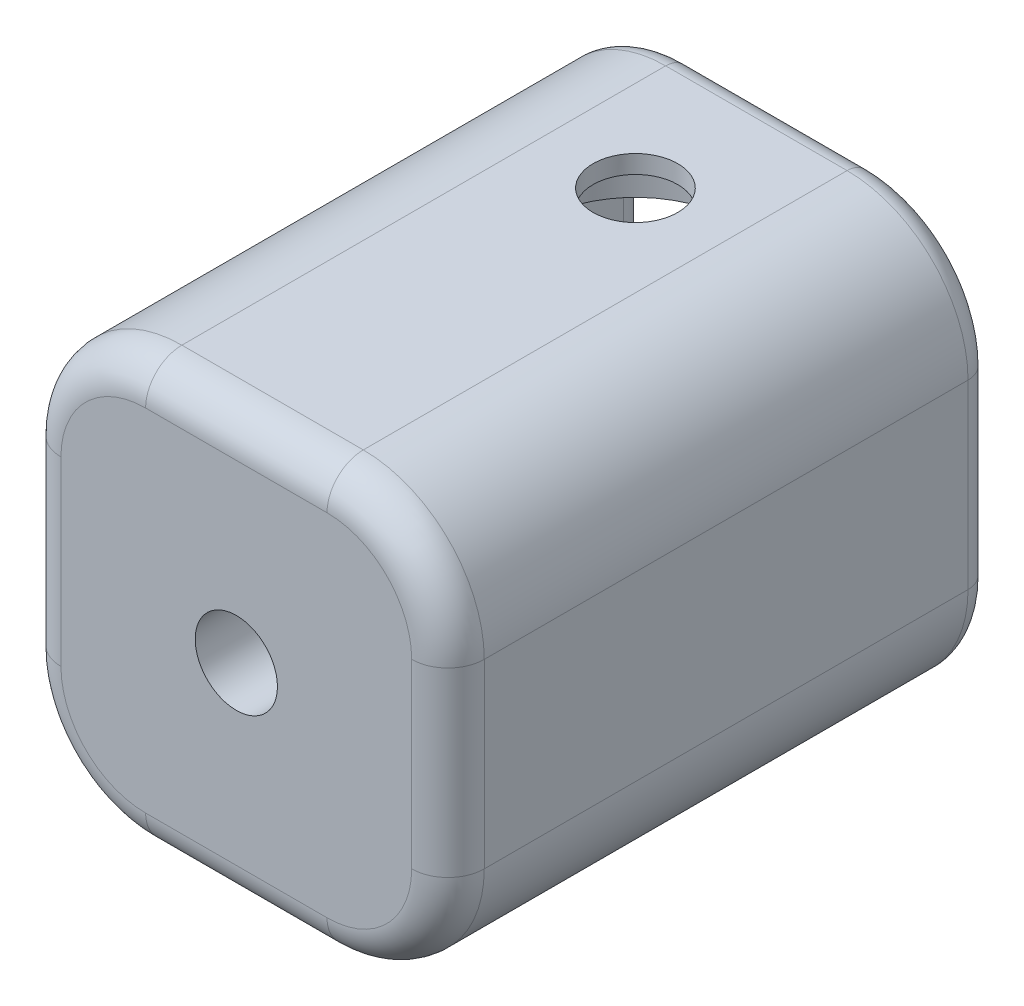
from build123d import *

# Parameters (mm, degrees)
SKETCH1_W                = 35
SKETCH1_H                = 35
SKETCH1_W_2              = 22
SKETCH1_H_2              = 22
BOSS_EXTRUDE1_DEPTH      = 30
SKETCH3_R                = 3.5
CUT_EXTRUDE2_DEPTH       = 50.307707308
SKETCH4_R                = 8.25
CUT_EXTRUDE3_DEPTH       = 5
FILLET1_R                = 10
FILLET4_R                = 2
FILLET5_R                = 3
NUT_START                = 15
NUT_RETENTION_AREA_DEPTH = 15
CUT_EXTRUDE5_DEPTH       = 8
SKETCH7_R                = 3.4
CUT_EXTRUDE6_DEPTH       = 52.356596548
FILLET6_R                = 3
FILLET7_R                = 2


with BuildPart() as part:
    # Sketch1 → Boss-Extrude1 (new body)
    with BuildSketch(Plane.XY):
        Rectangle(SKETCH1_W, SKETCH1_H)
        Rectangle(SKETCH1_W_2, SKETCH1_H_2, mode=Mode.SUBTRACT)
    extrude(amount=BOSS_EXTRUDE1_DEPTH)

    # Sketch3 → Cut-Extrude2 (cut, through all)
    with BuildSketch(Plane(origin=(0, 17.5, 0), x_dir=(1, 0, 0), z_dir=(0, 1, 0))):
        with Locations((0, -12)):
            Circle(SKETCH3_R)
    extrude(amount=-CUT_EXTRUDE2_DEPTH, mode=Mode.SUBTRACT)

    # Sketch4 → Cut-Extrude3 (cut)
    with BuildSketch(Plane(origin=(0, -11, 0), x_dir=(1, 0, 0), z_dir=(0, 1, 0))):
        with Locations((0, -12)):
            Circle(SKETCH4_R)
    cut_extrude3 = extrude(amount=-CUT_EXTRUDE3_DEPTH, mode=Mode.SUBTRACT)

    # Mirror2: Cut-Extrude3 across plane
    add(cut_extrude3.mirror(Plane.ZX), mode=Mode.SUBTRACT)

    # Fillet1
    fillet1_edges = [part.edges().sort_by_distance(p)[0] for p in [
        (17.5, 17.5, 15),
        (17.5, -17.5, 15),
        (-17.5, -17.5, 15),
        (-17.5, 17.5, 15),
    ]]
    fillet(fillet1_edges, radius=FILLET1_R)

    # Fillet4
    fillet4_edges = [part.edges().sort_by_distance(p)[0] for p in [
        (14.571067812, 14.571067812, 0),
        (17.5, 0, 0),
        (14.571067812, -14.571067812, 0),
        (0, -17.5, 0),
        (-14.571067812, -14.571067812, 0),
        (-17.5, 0, 0),
        (-14.571067812, 14.571067812, 0),
        (0, 17.5, 0),
    ]]
    fillet(fillet4_edges, radius=FILLET4_R)

    # Fillet5
    fillet5_edges = [part.edges().sort_by_distance(p)[0] for p in [
        (-11, 11, 15),
        (11, 11, 15),
        (11, -11, 15),
        (-11, -11, 15),
    ]]
    fillet(fillet5_edges, radius=FILLET5_R)

    # Sketch6 → Nut Retention Area (add)
    with BuildSketch(Plane.XY.offset(30).offset(NUT_START)):
        with BuildLine():
            Line((7.5, 17.5), (-7.5, 17.5))
            ThreePointArc((-7.5, 17.5), (-14.571067812, 14.571067812), (-17.5, 7.5))
            Line((-17.5, 7.5), (-17.5, -7.5))
            ThreePointArc((-17.5, -7.5), (-14.571067812, -14.571067812), (-7.5, -17.5))
            Line((-7.5, -17.5), (7.5, -17.5))
            ThreePointArc((7.5, -17.5), (14.571067812, -14.571067812), (17.5, -7.5))
            Line((17.5, -7.5), (17.5, 7.5))
            ThreePointArc((17.5, 7.5), (14.571067812, 14.571067812), (7.5, 17.5))
        make_face()
    extrude(amount=-NUT_RETENTION_AREA_DEPTH)

    # Sketch8 → Cut-Extrude5 (cut)
    with BuildSketch(Plane(origin=(0, 0, 30), x_dir=(-1, 0, 0), z_dir=(0, 0, -1))):
        Polygon((3.233161507, -5.6), (6.466323015, 0), (3.233161507, 5.6), (-3.233161507, 5.6), (-6.466323015, 0), (-3.233161507, -5.6), align=None)
    extrude(amount=-CUT_EXTRUDE5_DEPTH, mode=Mode.SUBTRACT)

    # Sketch7 → Cut-Extrude6 (cut, through all)
    with BuildSketch(Plane.XY.offset(45)):
        Circle(SKETCH7_R)
    extrude(amount=-CUT_EXTRUDE6_DEPTH, mode=Mode.SUBTRACT)

    # Fillet6
    fillet6_edges = [part.edges().sort_by_distance(p)[0] for p in [
        (0, 17.5, 45),
        (14.571067812, 14.571067812, 45),
        (17.5, 0, 45),
        (14.571067812, -14.571067812, 45),
        (0, -17.5, 45),
        (-14.571067812, -14.571067812, 45),
        (-17.5, 0, 45),
        (-14.571067812, 14.571067812, 45),
    ]]
    fillet(fillet6_edges, radius=FILLET6_R)

    # Fillet7
    fillet7_edges = [part.edges().sort_by_distance(p)[0] for p in [
        (10.121320344, 10.121320344, 0),
        (11, 0, 0),
        (10.121320344, -10.121320344, 0),
        (0, -11, 0),
        (-10.121320344, -10.121320344, 0),
        (-11, 0, 0),
        (-10.121320344, 10.121320344, 0),
        (0, 11, 0),
    ]]
    fillet(fillet7_edges, radius=FILLET7_R)


solid = part.part
